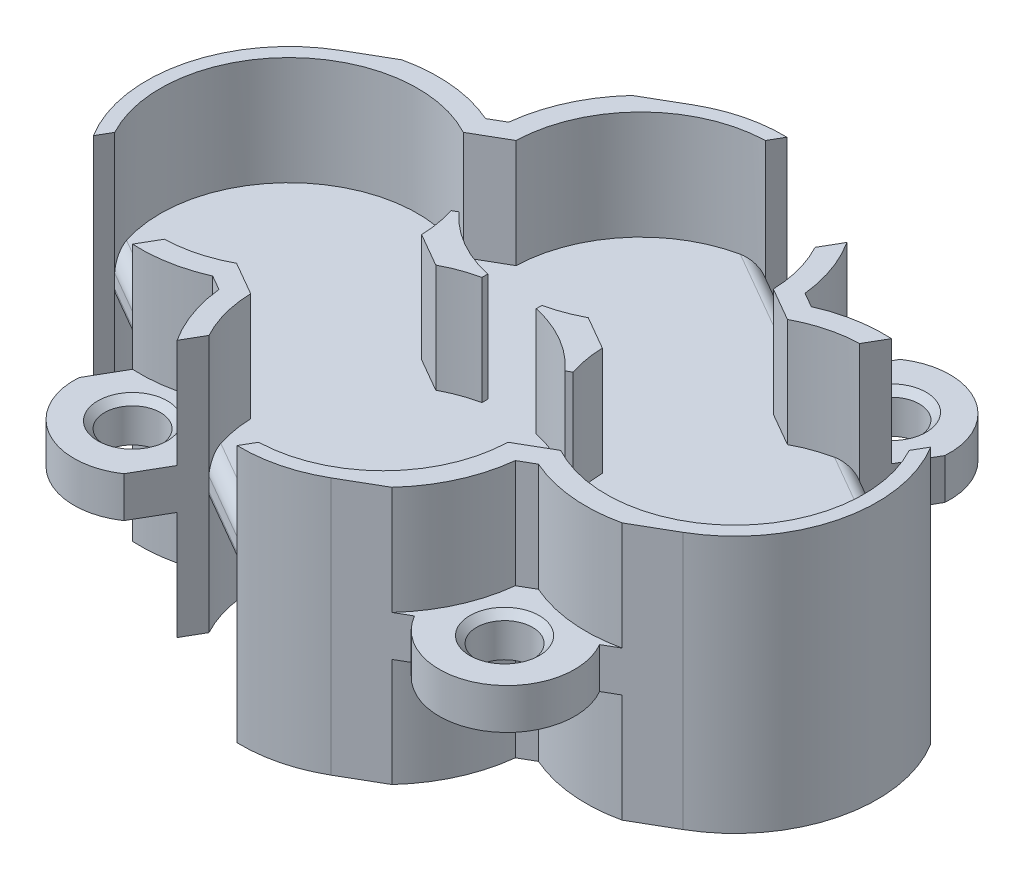
from build123d import *

# Parameters (mm, degrees)
SKETCH1_R                = 9.5
BOSS_EXTRUDE1_DEPTH      = 3
SKETCH1_4_R              = 9.5
BOSS_EXTRUDE2_DEPTH      = 3
BOSS_EXTRUDE3_START      = 8
BOSS_EXTRUDE3_DEPTH      = 19
BOSS_EXTRUDE4_DEPTH      = 3
CUT_EXTRUDE1_REACH       = 37.321
SKETCH4_R                = 2.0625
CHAMFER1_SIZE            = 0.5
CHAMFER1_OF_MIRROR1_SIZE = 0.5
CUT_EXTRUDE2_REACH       = 40.569
FILLET1_R                = 1
BOSS_EXTRUDE5_DEPTH      = 8
BOSS_EXTRUDE5_DEPTH_BACK = 11


with BuildPart() as part:
    # Sketch1 → Boss-Extrude1 (new body)
    with BuildSketch(Plane(origin=(0, 0, 0), x_dir=(1, 0, 0), z_dir=(0, 1, 0))):
        with BuildLine():
            Line((-5.25, 18.59326674), (-21.704482672, 9.09326674))
            ThreePointArc((-21.704482672, 9.09326674), (-26.954482672, 0), (-21.704482672, -9.09326674))
            Line((-21.704482672, -9.09326674), (-5.25, -18.59326674))
            ThreePointArc((-5.25, -18.59326674), (0, -20), (5.25, -18.59326674))
            Line((5.25, -18.59326674), (21.704482672, -9.09326674))
            ThreePointArc((21.704482672, -9.09326674), (26.954482672, 0), (21.704482672, 9.09326674))
            Line((21.704482672, 9.09326674), (5.25, 18.59326674))
            ThreePointArc((5.25, 18.59326674), (0, 20), (-5.25, 18.59326674))
        make_face()
        with Locations(Location((0, -9.5, 0), (0, 0, 90))):
            Circle(SKETCH1_R, mode=Mode.SUBTRACT)
    extrude(amount=-BOSS_EXTRUDE1_DEPTH)

    # Sketch1<4> → Boss-Extrude2 (add)
    with BuildSketch(Plane(origin=(0, 0, 0), x_dir=(1, 0, 0), z_dir=(0, 1, 0))):
        with Locations((0, 9.5)):
            Circle(SKETCH1_4_R)
        with Locations((0, -9.5)):
            Circle(SKETCH1_4_R)
    extrude(amount=-BOSS_EXTRUDE2_DEPTH)

    # Sketch1<6> → Boss-Extrude3 (add)
    with BuildSketch(Plane(origin=(0, 0, 0), x_dir=(1, 0, 0), z_dir=(0, 1, 0)).offset(BOSS_EXTRUDE3_START)):
        with BuildLine():
            ThreePointArc((-11.958948382, -8.369000624), (-25.954482672, 0), (-11.958948382, 8.369000624))
            Line((-11.958948382, 8.369000624), (-9.49553429, 9.791253414))
            ThreePointArc((-9.49553429, 9.791253414), (-6.613739206, 16.319710677), (0, 19))
            Line((0, 19), (0, 20))
            ThreePointArc((0, 20), (-2.717599974, 19.642221176), (-5.25, 18.59326674))
            Line((-5.25, 18.59326674), (-8.089454173, 16.953907109))
            ThreePointArc((-8.089454173, 16.953907109), (-10.01434129, 14.051150241), (-10.935213074, 10.692105287))
            ThreePointArc((-10.935213074, 10.692105287), (-10.982339992, 10.123063642), (-10.999875463, 9.552343178))
            ThreePointArc((-10.999875463, 9.552343178), (-11.502901618, 9.822517247), (-12.019269597, 10.066224962))
            ThreePointArc((-12.019269597, 10.066224962), (-15.388723752, 10.94824908), (-18.865028499, 10.732626371))
            Line((-18.865028499, 10.732626371), (-21.704482672, 9.09326674))
            ThreePointArc((-21.704482672, 9.09326674), (-26.954482672, 0), (-21.704482672, -9.09326674))
            Line((-21.704482672, -9.09326674), (-18.865028499, -10.732626371))
            ThreePointArc((-18.865028499, -10.732626371), (-15.388723752, -10.94824908), (-12.019269597, -10.066224962))
            ThreePointArc((-12.019269597, -10.066224962), (-11.502901618, -9.822517247), (-10.999875463, -9.552343178))
            ThreePointArc((-10.999875463, -9.552343178), (-10.982339992, -10.123063642), (-10.935213074, -10.692105287))
            ThreePointArc((-10.935213074, -10.692105287), (-10.01434129, -14.051150241), (-8.089454173, -16.953907109))
            Line((-8.089454173, -16.953907109), (-5.25, -18.59326674))
            ThreePointArc((-5.25, -18.59326674), (-2.717599974, -19.642221176), (0, -20))
            Line((0, -20), (0, -19))
            ThreePointArc((0, -19), (-6.613739206, -16.319710677), (-9.49553429, -9.791253414))
            Line((-9.49553429, -9.791253414), (-11.958948382, -8.369000624))
        make_face()
        with BuildLine():
            ThreePointArc((-10.999875463, 9.552343178), (-10.982339992, 10.123063642), (-10.935213074, 10.692105287))
            Line((-10.935213074, 10.692105287), (-12.019269597, 10.066224962))
            ThreePointArc((-12.019269597, 10.066224962), (-11.502901618, 9.822517247), (-10.999875463, 9.552343178))
        make_face()
        with BuildLine():
            Line((-12.019269597, -10.066224962), (-10.935213074, -10.692105287))
            ThreePointArc((-10.935213074, -10.692105287), (-10.982339992, -10.123063642), (-10.999875463, -9.552343178))
            ThreePointArc((-10.999875463, -9.552343178), (-11.502901618, -9.822517247), (-12.019269597, -10.066224962))
        make_face()
    boss_extrude3 = extrude(amount=-BOSS_EXTRUDE3_DEPTH)

    # Sketch3 → Boss-Extrude4 (add)
    with BuildSketch(Plane(origin=(0, 0, 0), x_dir=(1, 0, 0), z_dir=(0, 1, 0))):
        with BuildLine():
            Line((-17.807368355, -11.34326674), (-9.147114317, -16.34326674))
            ThreePointArc((-9.147114317, -16.34326674), (-15.977241336, -18.173393759), (-17.807368355, -11.34326674))
        make_face()
        with BuildLine():
            Line((-17.807368355, 11.34326674), (-9.147114317, 16.34326674))
            ThreePointArc((-9.147114317, 16.34326674), (-15.977241336, 18.173393759), (-17.807368355, 11.34326674))
        make_face()
    boss_extrude4 = extrude(amount=-BOSS_EXTRUDE4_DEPTH)

    # Sketch4 → Cut-Extrude1 (cut, up to next)
    with BuildSketch(Plane(origin=(0, 0, 0), x_dir=(1, 0, 0), z_dir=(0, 1, 0)), mode=Mode.PRIVATE) as cut_extrude1_sk1:
        with Locations(Location((-13.727241336, -14.276279442, 0), (0, 0, 270))):
            Circle(SKETCH4_R)
    cut_extrude1_tool1 = extrude(cut_extrude1_sk1.sketch, amount=-CUT_EXTRUDE1_REACH, mode=Mode.PRIVATE) & part.part
    # Sketch4 → Cut-Extrude1 (cut, up to next)
    with BuildSketch(Plane(origin=(0, 0, 0), x_dir=(1, 0, 0), z_dir=(0, 1, 0)), mode=Mode.PRIVATE) as cut_extrude1_sk2:
        with Locations(Location((-13.727241336, 14.276279442, 0), (0, 0, 270))):
            Circle(SKETCH4_R)
    cut_extrude1_tool2 = extrude(cut_extrude1_sk2.sketch, amount=-CUT_EXTRUDE1_REACH, mode=Mode.PRIVATE) & part.part
    cut_extrude1_1 = cut_extrude1_tool1.solids().sort_by_distance((-13.727241, 0, 14.276279))[0]
    add(cut_extrude1_1, mode=Mode.SUBTRACT)
    cut_extrude1_2 = cut_extrude1_tool2.solids().sort_by_distance((-13.727241, 0, -14.276279))[0]
    add(cut_extrude1_2, mode=Mode.SUBTRACT)
    cut_extrude1 = cut_extrude1_1 + cut_extrude1_2  # Cut-Extrude1 as one shape, for the pattern or mirror that repeats it

    # Chamfer1
    chamfer1_edges = [part.edges().sort_by_distance(p)[0] for p in [
        (-13.727241336, 0, -16.338779442),
        (-13.727241336, 0, 12.213779442),
    ]]
    chamfer(chamfer1_edges, length=CHAMFER1_SIZE)

    # Mirror1: Boss-Extrude3, Boss-Extrude4, Cut-Extrude1 across plane
    add(boss_extrude3.mirror(Plane(origin=(0, 0, 0), x_dir=(0, 0, 1), z_dir=(1, 0, 0))))
    add(boss_extrude4.mirror(Plane(origin=(0, 0, 0), x_dir=(0, 0, 1), z_dir=(1, 0, 0))))
    add(cut_extrude1.mirror(Plane(origin=(0, 0, 0), x_dir=(0, 0, 1), z_dir=(1, 0, 0))), mode=Mode.SUBTRACT)

    # Chamfer1 of Mirror1
    chamfer1_of_mirror1_edges = [part.edges().sort_by_distance(p)[0] for p in [
        (13.727241336, 0, -16.338779442),
        (13.727241336, 0, 12.213779442),
    ]]
    chamfer(chamfer1_of_mirror1_edges, length=CHAMFER1_OF_MIRROR1_SIZE)

    # Sketch5 → Cut-Extrude2 (cut, up to next)
    with BuildSketch(Plane(origin=(0, 8, 0), x_dir=(1, 0, 0), z_dir=(0, 1, 0)), mode=Mode.PRIVATE) as cut_extrude2_sk1:
        Polygon((-24.823483296, -4.49553429), (-16.163229258, -9.49553429), (-18.464080389, -13.480725349), (-27.124334427, -8.480725349), align=None)
    cut_extrude2_tool1 = extrude(cut_extrude2_sk1.sketch, amount=-CUT_EXTRUDE2_REACH, mode=Mode.PRIVATE) & part.part
    # Sketch5 → Cut-Extrude2 (cut, up to next)
    with BuildSketch(Plane(origin=(0, 8, 0), x_dir=(1, 0, 0), z_dir=(0, 1, 0)), mode=Mode.PRIVATE) as cut_extrude2_sk2:
        Polygon((-8.369000624, -13.99553429), (0.291253414, -18.99553429), (-2.009597717, -22.980725349), (-10.669851755, -17.980725349), align=None)
    cut_extrude2_tool2 = extrude(cut_extrude2_sk2.sketch, amount=-CUT_EXTRUDE2_REACH, mode=Mode.PRIVATE) & part.part
    # Sketch5 → Cut-Extrude2 (cut, up to next)
    with BuildSketch(Plane(origin=(0, 8, 0), x_dir=(1, 0, 0), z_dir=(0, 1, 0)), mode=Mode.PRIVATE) as cut_extrude2_sk3:
        Polygon((-0.291253414, 18.99553429), (8.369000624, 13.99553429), (10.669851755, 17.980725349), (2.009597717, 22.980725349), align=None)
    cut_extrude2_tool3 = extrude(cut_extrude2_sk3.sketch, amount=-CUT_EXTRUDE2_REACH, mode=Mode.PRIVATE) & part.part
    # Sketch5 → Cut-Extrude2 (cut, up to next)
    with BuildSketch(Plane(origin=(0, 8, 0), x_dir=(1, 0, 0), z_dir=(0, 1, 0)), mode=Mode.PRIVATE) as cut_extrude2_sk4:
        Polygon((16.163229258, 9.49553429), (24.823483296, 4.49553429), (27.124334427, 8.480725349), (18.464080389, 13.480725349), align=None)
    cut_extrude2_tool4 = extrude(cut_extrude2_sk4.sketch, amount=-CUT_EXTRUDE2_REACH, mode=Mode.PRIVATE) & part.part
    add(cut_extrude2_tool1.solids().sort_by_distance((-21.643782, 8, 8.98813))[0], mode=Mode.SUBTRACT)
    add(cut_extrude2_tool2.solids().sort_by_distance((-5.189299, 8, 18.48813))[0], mode=Mode.SUBTRACT)
    add(cut_extrude2_tool3.solids().sort_by_distance((5.189299, 8, -18.48813))[0], mode=Mode.SUBTRACT)
    add(cut_extrude2_tool4.solids().sort_by_distance((21.643782, 8, -8.98813))[0], mode=Mode.SUBTRACT)

    # Fillet1
    # the kernel refuses this fillet: 1 mm, written as the material it takes off along each edge
    with BuildSketch(Plane(origin=(-13.998165749, 0, 10.74553429), x_dir=(0.49999999999999956, 0, -0.866025403784439), z_dir=(-0.8660254037844389, 0, -0.4999999999999995))) as fillet1_piece_1_section:
        with BuildLine():
            CenterArc((FILLET1_R, FILLET1_R), FILLET1_R, 180, 90)
            Line((0, FILLET1_R), (0, 0))
            Line((0, 0), (FILLET1_R, 0))
        make_face()
    fillet1_piece_1 = extrude(amount=15, mode=Mode.PRIVATE)
    fillet1_piece_1 = fillet1_piece_1 & Plane(origin=(-16.454482672, -0.134031424, 0), x_dir=(0.47321413577016985, 0, 0.8809474341340074), z_dir=(0, 1, 0)) * Cylinder(9.5, 34, mode=Mode.PRIVATE)
    add(fillet1_piece_1, mode=Mode.SUBTRACT)
    with BuildSketch(Plane(origin=(-13.998165749, -3, 10.74553429), x_dir=(0.49999999999999956, 0, -0.866025403784439), z_dir=(-0.8660254037844389, 0, -0.4999999999999995))) as fillet1_piece_2_section:
        with BuildLine():
            CenterArc((FILLET1_R, -FILLET1_R), FILLET1_R, 90, 90)
            Line((0, -FILLET1_R), (0, 0))
            Line((0, 0), (FILLET1_R, 0))
        make_face()
    fillet1_piece_2 = extrude(amount=15, mode=Mode.PRIVATE)
    fillet1_piece_2 = fillet1_piece_2 & Plane(origin=(-16.454482672, -2.865968576, 0), x_dir=(0.47321413577016985, 0, 0.8809474341340074), z_dir=(0, 1, 0)) * Cylinder(9.5, 34, mode=Mode.PRIVATE)
    add(fillet1_piece_2, mode=Mode.SUBTRACT)
    with BuildSketch(Plane(origin=(2.456316923, 0, 20.24553429), x_dir=(0, -1, 0), z_dir=(-0.8660254037844387, 0, -0.5000000000000001))) as fillet1_piece_3_section:
        with BuildLine():
            CenterArc((FILLET1_R, -FILLET1_R), FILLET1_R, 90, 90)
            Line((0, -FILLET1_R), (0, 0))
            Line((0, 0), (FILLET1_R, 0))
        make_face()
    fillet1_piece_3 = extrude(amount=15, mode=Mode.PRIVATE)
    fillet1_piece_3 = fillet1_piece_3 & Plane(origin=(0, -0.134033737, 9.5), x_dir=(0, 0, 1), z_dir=(0, 1, 0)) * Cylinder(9.5, 35, mode=Mode.PRIVATE)
    add(fillet1_piece_3, mode=Mode.SUBTRACT)
    with BuildSketch(Plane(origin=(2.456316923, -3, 20.24553429), x_dir=(0, 1, 0), z_dir=(-0.8660254037844387, 0, -0.5000000000000001))) as fillet1_piece_4_section:
        with BuildLine():
            CenterArc((FILLET1_R, FILLET1_R), FILLET1_R, 180, 90)
            Line((0, FILLET1_R), (0, 0))
            Line((0, 0), (FILLET1_R, 0))
        make_face()
    fillet1_piece_4 = extrude(amount=15, mode=Mode.PRIVATE)
    fillet1_piece_4 = fillet1_piece_4 & Plane(origin=(0, -2.865966263, 9.5), x_dir=(0, 0, 1), z_dir=(0, 1, 0)) * Cylinder(9.5, 35, mode=Mode.PRIVATE)
    add(fillet1_piece_4, mode=Mode.SUBTRACT)
    with BuildSketch(Plane(origin=(10.534064134, 0, -12.74553429), x_dir=(-0.4999999999999997, 0, 0.8660254037844389), z_dir=(-0.8660254037844388, 0, -0.49999999999999967))) as fillet1_piece_5_section:
        with BuildLine():
            CenterArc((FILLET1_R, -FILLET1_R), FILLET1_R, 90, 90)
            Line((0, -FILLET1_R), (0, 0))
            Line((0, 0), (FILLET1_R, 0))
        make_face()
    fillet1_piece_5 = extrude(amount=15, mode=Mode.PRIVATE)
    fillet1_piece_5 = fillet1_piece_5 & Plane(origin=(0, -0.134037096, -9.5), x_dir=(-0.9995299252438539, 0, -0.030658254060138262), z_dir=(0, 1, 0)) * Cylinder(9.5, 35, mode=Mode.PRIVATE)
    add(fillet1_piece_5, mode=Mode.SUBTRACT)
    with BuildSketch(Plane(origin=(10.534064134, -3, -12.74553429), x_dir=(-0.4999999999999997, 0, 0.8660254037844389), z_dir=(-0.8660254037844388, 0, -0.49999999999999967))) as fillet1_piece_6_section:
        with BuildLine():
            CenterArc((FILLET1_R, FILLET1_R), FILLET1_R, 180, 90)
            Line((0, FILLET1_R), (0, 0))
            Line((0, 0), (FILLET1_R, 0))
        make_face()
    fillet1_piece_6 = extrude(amount=15, mode=Mode.PRIVATE)
    fillet1_piece_6 = fillet1_piece_6 & Plane(origin=(0, -2.865962904, -9.5), x_dir=(-0.9995299252438539, 0, -0.030658254060138262), z_dir=(0, 1, 0)) * Cylinder(9.5, 35, mode=Mode.PRIVATE)
    add(fillet1_piece_6, mode=Mode.SUBTRACT)
    with BuildSketch(Plane(origin=(26.988546806, 0, -3.24553429), x_dir=(-0.4999999999999998, 0, 0.8660254037844387), z_dir=(-0.8660254037844388, 0, -0.49999999999999983))) as fillet1_piece_7_section:
        with BuildLine():
            CenterArc((FILLET1_R, -FILLET1_R), FILLET1_R, 90, 90)
            Line((0, -FILLET1_R), (0, 0))
            Line((0, 0), (FILLET1_R, 0))
        make_face()
    fillet1_piece_7 = extrude(amount=15, mode=Mode.PRIVATE)
    fillet1_piece_7 = fillet1_piece_7 & Plane(origin=(16.454482672, -0.134031424, 0), x_dir=(-0.47321413577016985, 0, 0.8809474341340074), z_dir=(0, 1, 0)) * Cylinder(9.5, 34, mode=Mode.PRIVATE)
    add(fillet1_piece_7, mode=Mode.SUBTRACT)
    with BuildSketch(Plane(origin=(26.988546806, -3, -3.24553429), x_dir=(0, 1, 0), z_dir=(-0.8660254037844388, 0, -0.49999999999999983))) as fillet1_piece_8_section:
        with BuildLine():
            CenterArc((FILLET1_R, -FILLET1_R), FILLET1_R, 90, 90)
            Line((0, -FILLET1_R), (0, 0))
            Line((0, 0), (FILLET1_R, 0))
        make_face()
    fillet1_piece_8 = extrude(amount=15, mode=Mode.PRIVATE)
    fillet1_piece_8 = fillet1_piece_8 & Plane(origin=(16.454482672, -2.865966111, 0), x_dir=(-0.47321413577016985, 0, 0.8809474341340074), z_dir=(0, 1, 0)) * Cylinder(9.5, 34, mode=Mode.PRIVATE)
    add(fillet1_piece_8, mode=Mode.SUBTRACT)

    # Sketch6 → Boss-Extrude5 (add, two sides: drawn at the far end of the back side and taken through both)
    with BuildSketch(Plane(origin=(0, 0, 0), x_dir=(1, 0, 0), z_dir=(0, 1, 0)).offset(-BOSS_EXTRUDE5_DEPTH_BACK)):
        with BuildLine():
            ThreePointArc((-7.411628701, 2.911493098), (-7.093159377, 1.617289761), (-6.958948382, 0.291253414))
            Line((-6.958948382, 0.291253414), (-4.49553429, -1.130999376))
            ThreePointArc((-4.49553429, -1.130999376), (-3.280047629, -0.584211333), (-2, -0.212912189))
            Line((-2, -0.212912189), (-2, 0.212912189))
            ThreePointArc((-2, 0.212912189), (-4.75, 1.272758664), (-7.042853971, 3.124405287))
            Line((-7.042853971, 3.124405287), (-7.411628701, 2.911493098))
        make_face()
        with BuildLine():
            ThreePointArc((4.49553429, 1.130999376), (3.280047629, 0.584211333), (2, 0.212912189))
            Line((2, 0.212912189), (2, -0.212912189))
            ThreePointArc((2, -0.212912189), (4.75, -1.272758664), (7.042853971, -3.124405287))
            Line((7.042853971, -3.124405287), (7.411628701, -2.911493098))
            ThreePointArc((7.411628701, -2.911493098), (7.093159377, -1.617289761), (6.958948382, -0.291253414))
            Line((6.958948382, -0.291253414), (4.49553429, 1.130999376))
        make_face()
    extrude(amount=BOSS_EXTRUDE5_DEPTH + BOSS_EXTRUDE5_DEPTH_BACK)


solid = part.part
